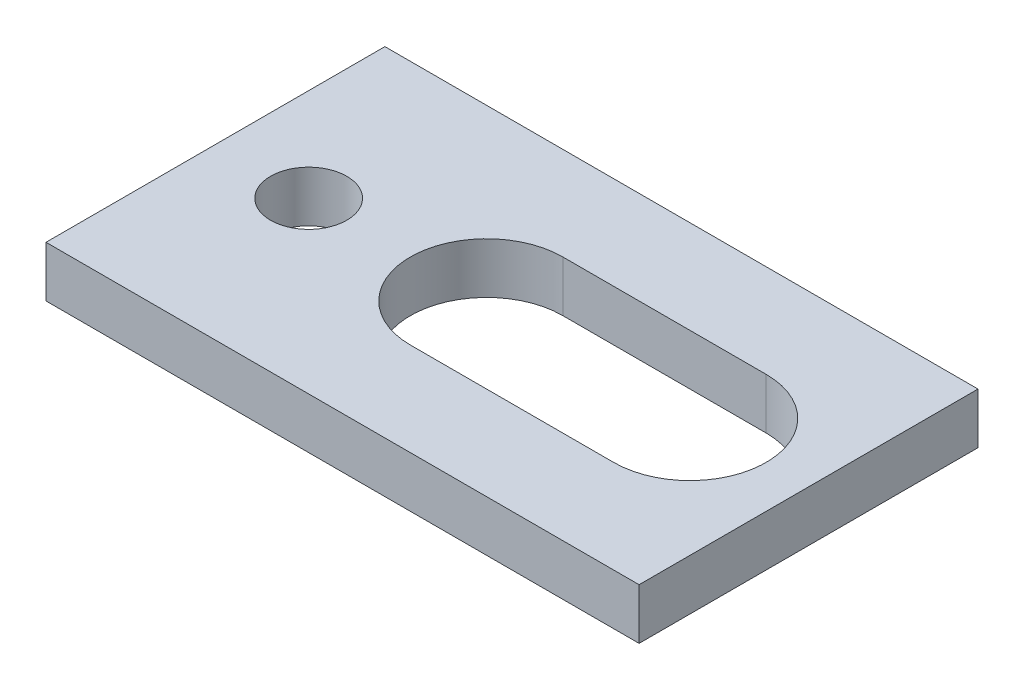
from build123d import *

# Parameters (mm, degrees)
SKETCH1_W                = 35
SKETCH1_H                = 20
BOSS_EXTRUDE1_DEPTH      = 3
M8_CLEARANCE_SLOT1_DEPTH = 3
M4_CLEARANCE_SLOT1_D     = 4.5


# Read off the part's stored shape, not the designer's step: M8 Clearance Slot1
with BuildPart() as part:
    # Sketch1 → Boss-Extrude1 (new body)
    with BuildSketch(Plane(origin=(0, 0, 0), x_dir=(1, 0, 0), z_dir=(0, 1, 0))):
        with Locations((-7.459731544, -5.86409396)):
            Rectangle(SKETCH1_W, SKETCH1_H)
    extrude(amount=BOSS_EXTRUDE1_DEPTH)

    # M8 Clearance Slot1 outline → M8 Clearance Slot1 (cut)
    with BuildSketch(Plane(origin=(0, 0, 0), x_dir=(1, 0, 0), z_dir=(0, 1, 0))):
        with BuildLine():
            Line((-8.959731544, -10.36409396), (3.040268456, -10.36409396))
            ThreePointArc((3.040268456, -10.36409396), (7.540268456, -5.86409396), (3.040268456, -1.36409396))
            Line((3.040268456, -1.36409396), (-8.959731544, -1.36409396))
            ThreePointArc((-8.959731544, -1.36409396), (-13.459731544, -5.86409396), (-8.959731544, -10.36409396))
        make_face()
    extrude(amount=M8_CLEARANCE_SLOT1_DEPTH, mode=Mode.SUBTRACT)

    # M4 Clearance Slot1 (through all)
    with Locations(Plane(origin=(0, 3, 0), x_dir=(1, 0, 0), z_dir=(0, 1, 0))):
        with Locations((-19.459731544, -5.86409396)):
            Hole(M4_CLEARANCE_SLOT1_D / 2)


solid = part.part
